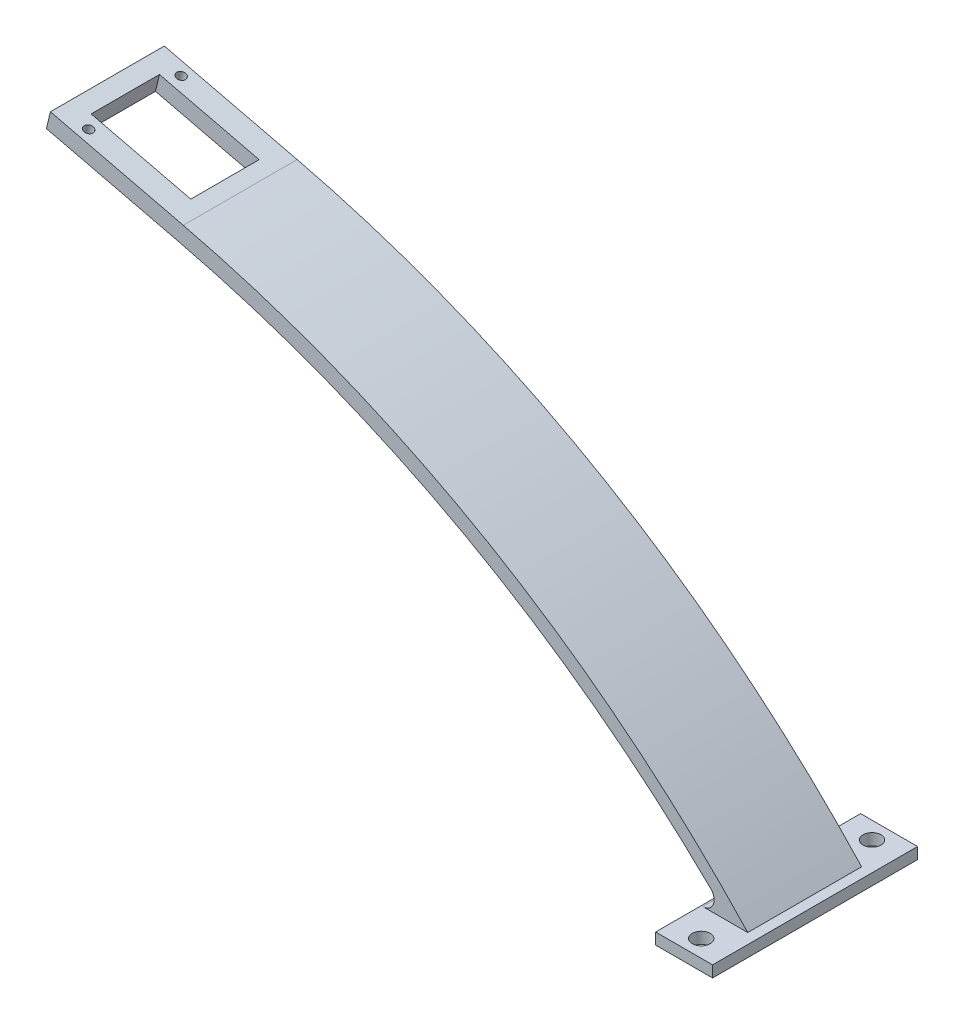
from build123d import *

# Parameters (mm, degrees)
BOSS_EXTRUDE1_DEPTH = 25.4
CUT_EXTRUDE1_REACH  = 175.019
SKETCH2_R           = 0.99949
SKETCH2_W           = 22.86
SKETCH2_H           = 15.24
SKETCH3_W           = 12.7
SKETCH3_H           = 45.72
SKETCH3_R           = 2
BOSS_EXTRUDE2_DEPTH = 2.54
FILLET1_R           = 2.54


with BuildPart() as part:
    # Sketch1 → Boss-Extrude1 (new body)
    with BuildSketch(Plane.XY):
        with BuildLine():
            Line((-125.286554081, 72.495270603), (-154.924389255, 79.610685294))
            Line((-154.924389255, 79.610685294), (-154.034962419, 83.31541469))
            Line((-154.034962419, 83.31541469), (-124.397127245, 76.2))
            ThreePointArc((-124.397127245, 76.2), (-54.522922109, 47.809151847), (3.81, 0))
            Line((3.81, 0), (0, 0))
            ThreePointArc((0, 0), (-57.369788975, 45.36129392), (-125.286554081, 72.495270603))
        make_face()
    extrude(amount=BOSS_EXTRUDE1_DEPTH)

    # Sketch2 → Cut-Extrude1 (cut, up to next)
    with BuildSketch(Plane(origin=(10.5178004, 43.80979159, 0), x_dir=(0.9723699203976766, -0.23344536385590603, 0), z_dir=(0.23344536385590603, 0.9723699203976766, 0)), mode=Mode.PRIVATE) as cut_extrude1_sk1:
        with Locations((-162.878561443, -2.41681)):
            Circle(SKETCH2_R)
    cut_extrude1_tool1 = extrude(cut_extrude1_sk1.sketch, amount=-CUT_EXTRUDE1_REACH, mode=Mode.PRIVATE) & part.part
    # Sketch2 → Cut-Extrude1 (cut, up to next)
    with BuildSketch(Plane(origin=(10.5178004, 43.80979159, 0), x_dir=(0.9723699203976766, -0.23344536385590603, 0), z_dir=(0.23344536385590603, 0.9723699203976766, 0)), mode=Mode.PRIVATE) as cut_extrude1_sk2:
        with Locations((-162.878561443, -23.03399)):
            Circle(SKETCH2_R)
    cut_extrude1_tool2 = extrude(cut_extrude1_sk2.sketch, amount=-CUT_EXTRUDE1_REACH, mode=Mode.PRIVATE) & part.part
    # Sketch2 → Cut-Extrude1 (cut, up to next)
    with BuildSketch(Plane(origin=(10.5178004, 43.80979159, 0), x_dir=(0.9723699203976766, -0.23344536385590603, 0), z_dir=(0.23344536385590603, 0.9723699203976766, 0)), mode=Mode.PRIVATE) as cut_extrude1_sk3:
        with Locations((-153.683761443, -12.7)):
            Rectangle(SKETCH2_W, SKETCH2_H)
    cut_extrude1_tool3 = extrude(cut_extrude1_sk3.sketch, amount=-CUT_EXTRUDE1_REACH, mode=Mode.PRIVATE) & part.part
    add(cut_extrude1_tool1.solids().sort_by_distance((-147.860413, 81.833037, 2.41681))[0], mode=Mode.SUBTRACT)
    add(cut_extrude1_tool2.solids().sort_by_distance((-147.860413, 81.833037, 23.03399))[0], mode=Mode.SUBTRACT)
    add(cut_extrude1_tool3.solids().sort_by_distance((-138.919666, 79.686553, 12.7))[0], mode=Mode.SUBTRACT)

    # Sketch3 → Boss-Extrude2 (add)
    with BuildSketch(Plane(origin=(0, 0, 0), x_dir=(1, 0, 0), z_dir=(0, 1, 0))):
        with Locations((-2.54, -12.7)):
            Rectangle(SKETCH3_W, SKETCH3_H)
        with Locations((-2.54, 6.35)):
            Circle(SKETCH3_R, mode=Mode.SUBTRACT)
        with Locations((-2.54, -31.75)):
            Circle(SKETCH3_R, mode=Mode.SUBTRACT)
    extrude(amount=BOSS_EXTRUDE2_DEPTH)

    # Fillet1
    fillet1_edges = [part.edges().sort_by_distance(p)[0] for p in [
        (-2.434616907, 2.54, 12.7),
    ]]
    fillet(fillet1_edges, radius=FILLET1_R)


solid = part.part
